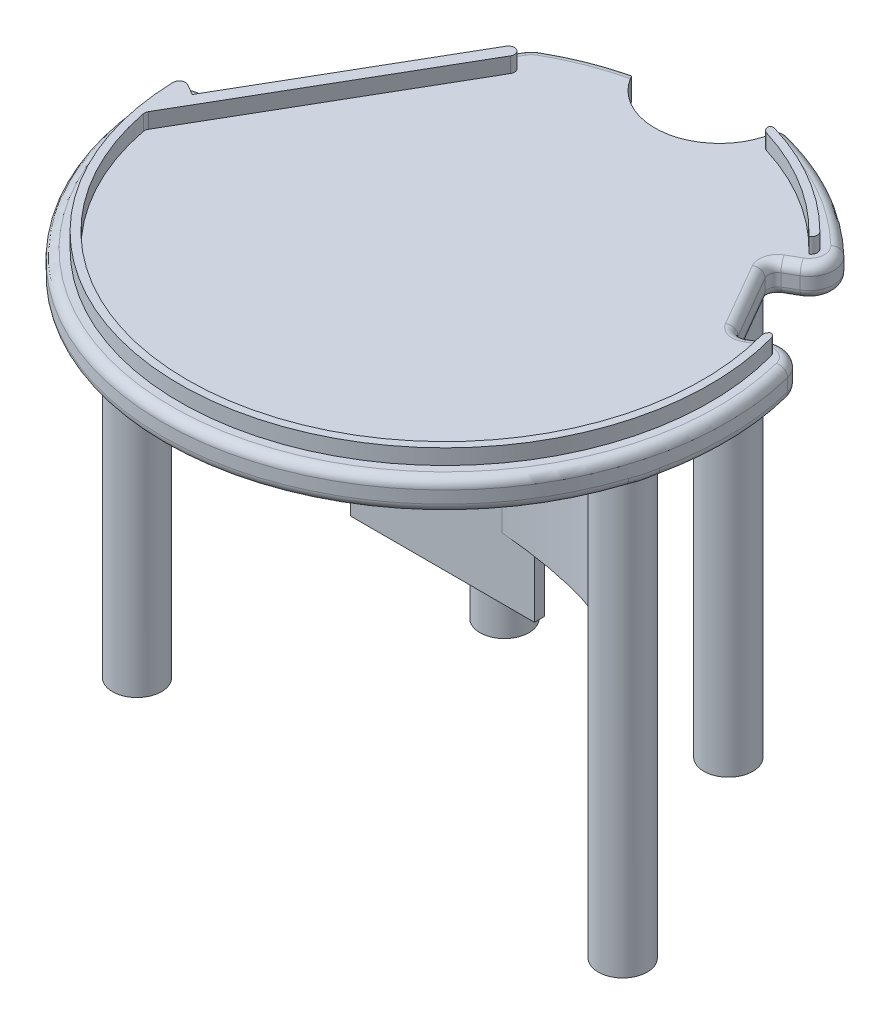
from build123d import *

# Parameters (mm, degrees)
BOSS_EXTRUDE1_DEPTH                  = 6.35
SKETCH9_R                            = 5.08
BOSS_EXTRUDE5_DEPTH                  = 88.9
BOSS_EXTRUDE6_DEPTH                  = 3.175
BOSS_EXTRUDE7_DEPTH                  = 38.1
FILLET14_R                           = 5.08
FILLET16_R                           = 1.905
FILLET17_R                           = 1.27
FILLET18_START                       = 6.35
FILLET18_DEPTH                       = 4.65
FILLET19_START                       = 6.35
FILLET19_DEPTH                       = 4.65
BOSS_EXTRUDE8_START                  = 0.508
SKETCH12_W                           = 38.1
SKETCH12_H                           = 50.8
BOSS_EXTRUDE8_DEPTH                  = 2.032
TAPPED_HOLE_FOR_4_40_HELICOIL2_D     = 3.048
TAPPED_HOLE_FOR_4_40_HELICOIL2_DEPTH = 8.128
TAPPED_HOLE_FOR_4_40_HELICOIL2_TIP   = 0.915711583


with BuildPart() as part:
    # Sketch1 → Boss-Extrude1 (new body)
    with BuildSketch(Plane(origin=(0, 0, 0), x_dir=(1, 0, 0), z_dir=(0, 1, 0))):
        with BuildLine():
            Line((-32.253592819, 37.099138511), (-40.254592819, 23.241))
            Line((-40.254592819, 23.241), (-51.728000474, 3.368475006))
            Line((-51.728000474, 3.368475006), (-58.000335883, 6.989809543))
            ThreePointArc((-58.000335883, 6.989809543), (7.066769016, -57.991009438), (54.624330022, 20.714221434))
            Line((54.624330022, 20.714221434), (45.017092819, 14.992108029))
            Line((45.017092819, 14.992108029), (35.492092819, 31.489891971))
            Line((35.492092819, 31.489891971), (45.153710606, 37.068029601))
            ThreePointArc((45.153710606, 37.068029601), (30.906009338, 49.575346563), (13.403434591, 56.861624503))
            ThreePointArc((13.403434591, 56.861624503), (2.74487785, 43.742260783), (-12.27919224, 51.488218063))
            ThreePointArc((-12.27919224, 51.488218063), (-20.066564561, 48.981099907), (-27.374593602, 45.30393787))
            Line((-27.374593602, 45.30393787), (-32.253592819, 37.099138511))
        make_face()
    extrude(amount=BOSS_EXTRUDE1_DEPTH)

    # Sketch9 → Boss-Extrude5 (add)
    with BuildSketch(Plane(origin=(0, 0, 0), x_dir=(1, 0, 0), z_dir=(0, 1, 0))):
        with Locations(Location((-50.295757775, -13.476707678, 0), (0, 0, 270))):
            Circle(SKETCH9_R)
        with Locations(Location((50.295757775, -13.476707678, 0), (0, 0, 270))):
            Circle(SKETCH9_R)
        with Locations(Location((-22.825821957, 35.148683503, 0), (0, 0, 270))):
            Circle(SKETCH9_R)
        with Locations(Location((25.22206762, 33.470814226, 0), (0, 0, 270))):
            Circle(SKETCH9_R)
    extrude(amount=-BOSS_EXTRUDE5_DEPTH)

    # Sketch11 → Boss-Extrude6 (add)
    with BuildSketch(Plane(origin=(0, 6.35, 0), x_dir=(1, 0, 0), z_dir=(0, 1, 0))):
        with BuildLine():
            Line((-50.720076519, -1.612859212), (-54.895840437, 0.79801921))
            ThreePointArc((-54.895840437, 0.79801921), (7.654945751, -54.365356041), (52.541042813, 15.925732386))
            Line((52.541042813, 15.925732386), (51.134548774, 15.088018252))
            ThreePointArc((51.134548774, 15.088018252), (12.383825031, -51.855869973), (-52.434288484, -9.645504875))
            Line((-52.434288484, -9.645504875), (-24.059325187, 39.382046715))
            Line((-24.059325187, 39.382046715), (-26.25769086, 40.654362857))
            Line((-26.25769086, 40.654362857), (-50.720076519, -1.612859212))
        make_face()
        with BuildLine():
            Line((38.582559864, 36.793701193), (39.996135536, 37.609829487))
            ThreePointArc((39.996135536, 37.609829487), (28.47417233, 46.940511736), (14.875659709, 52.847941115))
            Line((14.875659709, 52.847941115), (14.445506531, 51.31975949))
            ThreePointArc((14.445506531, 51.31975949), (27.49082663, 45.679807621), (38.582559864, 36.793701193))
        make_face()
    extrude(amount=BOSS_EXTRUDE6_DEPTH)

    # Sketch2 → Boss-Extrude7 (add)
    with BuildSketch(Plane(origin=(0, 0, 0), x_dir=(1, 0, 0), z_dir=(0, 1, 0))):
        with BuildLine():
            Line((-47.247757775, -13.476707678), (-45.215757775, -13.476707678))
            add(Edge.make_bspline(
                [(45.215757775, -13.476707678), (45.215757775, 0), (0, 0), (-45.215757775, 0), (-45.215757775, -13.476707678)],
                knots=[0, 0, 0, 1.570796327, 1.570796327, 3.141592654, 3.141592654, 3.141592654], degree=2, weights=[1, 0.707106781, 1, 0.707106781, 1]))
            Line((45.215757775, -13.476707678), (47.247757775, -13.476707678))
            add(Edge.make_bspline(
                [(47.247757775, -13.476707678), (47.247757775, 2.032), (0, 2.032), (-47.247757775, 2.032), (-47.247757775, -13.476707678)],
                knots=[0, 0, 0, 1.570796327, 1.570796327, 3.141592654, 3.141592654, 3.141592654], degree=2, weights=[1, 0.707106781, 1, 0.707106781, 1]))
        make_face()
    extrude(amount=-BOSS_EXTRUDE7_DEPTH)

    # Fillet14
    # the kernel refuses this fillet: 5.08 mm, written as the material it takes off along each edge
    with BuildSketch(Plane(origin=(45.153710606, -16.579017686, -37.068029601), x_dir=(-0.6773555259937207, 0, -0.7356558240140357), z_dir=(0, 1, 0))) as fillet14_piece_1:
        with BuildLine():
            CenterArc((6.343276332, 5.071810858), FILLET14_R, 167.362661461, 105.891082119)
            Line((1.386342405, 6.183209097), (1.287203727, 6.205437062))
            Line((1.287203727, 6.205437062), (-0.099138679, 0.022227965))
            Line((-0.099138679, 0.022227965), (-0.005766615, -0.101436217))
            ThreePointArc((-0.005766615, -0.101436217), (3.315803537, -0.195775129), (6.637373689, -0.101436217))
            Line((6.637373689, -0.101436217), (6.631607074, 0))
        make_face()
    extrude(amount=39.508035371, mode=Mode.SUBTRACT)
    with BuildSketch(Plane(origin=(-58.000335883, -21.483083714, -6.989809543), x_dir=(0.8660254037844359, 0, 0.5000000000000048), z_dir=(0, 1, 0))) as fillet14_piece_2:
        with BuildLine():
            CenterArc((8.275866801, -4.973821716), FILLET14_R, 101.734996991, 109.828725066)
            Line((3.947409441, -7.632930004), (3.860840294, -7.686112169))
            ThreePointArc((3.860840294, -7.686112169), (1.742923524, -3.935814698), (-0.093434207, -0.039907505))
            Line((-0.093434207, -0.039907505), (0, 0.1016))
            ThreePointArc((0, 0.1016), (3.621334537, 0.1016), (7.22200512, 0.099476434))
            Line((7.22200512, 0.099476434), (7.242669074, 0))
        make_face()
    extrude(amount=49.316167428, mode=Mode.SUBTRACT)
    with BuildSketch(Plane(origin=(54.624330022, -16.77772991, -20.714221434), x_dir=(-0.8591545066230238, 0, 0.5117162629322508), z_dir=(0, 1, 0))) as fillet14_piece_3:
        with BuildLine():
            CenterArc((6.412670414, 5.08), FILLET14_R, 163.403560084, 106.596439916)
            Line((1.544301569, 6.530994412), (1.446934192, 6.5600143))
            ThreePointArc((1.446934192, 6.5600143), (0.579417505, 3.311070405), (-0.100053119, 0.017661637))
            Line((-0.100053119, 0.017661637), (0, -0.1016))
            Line((0, -0.1016), (6.412670414, -0.1016))
            Line((6.412670414, -0.1016), (6.412670414, 0))
        make_face()
    extrude(amount=39.905459819, mode=Mode.SUBTRACT)
    with BuildSketch(Plane(origin=(-27.374593602, -3.435095162, -45.30393787), x_dir=(0.8625268635663396, 0, -0.5060112742087995), z_dir=(0, 1, 0))) as fillet14_piece_4:
        with BuildLine():
            CenterArc((1.308103561, -5.079572092), FILLET14_R, 89.256323848, 29.60725833)
            Line((-1.144143659, -0.630652722), (-1.193188604, -0.541674334))
            Line((-1.193188604, -0.541674334), (-0.049044944, 0.088978387))
            Line((-0.049044944, 0.088978387), (-0.00131869, 0.101591442))
            ThreePointArc((-0.00131869, 0.101591442), (0.687019032, 0.106058678), (1.375356755, 0.101591442))
            Line((1.375356755, 0.101591442), (1.374038065, 0))
        make_face()
    extrude(amount=13.220190325, mode=Mode.SUBTRACT)

    # Fillet16
    fillet16_edges = [part.edges().sort_by_distance(p)[0] for p in [
        (28.042389227, 0, -51.249593232),
        (8.001988008, 0, 57.869375216),
        (53.660044193, 0, -17.760877841),
        (-56.352470504, 0, -2.620122155),
        (42.167493863, 0, -37.675190195),
        (-27.233989523, 0, -45.210478507),
        (8.001988008, 6.35, 57.869375216),
        (28.042389227, 6.35, -51.249593232),
        (53.660044193, 6.35, -17.760877841),
        (-56.352470504, 6.35, -2.620122155),
        (42.167493863, 6.35, -37.675190195),
        (-27.233989523, 6.35, -45.210478507),
        (37.579021476, 0, -32.694780793),
        (40.254592819, 0, -23.241),
        (47.065974078, 0, -16.212430861),
        (-30.147961838, 6.35, -40.640085938),
        (-41.990796646, 0, -20.233806758),
        (-30.147961838, 0, -40.640085938),
        (-19.429137171, 0, -49.23742266),
        (2.74487785, 0, -43.742260783),
        (-41.990796646, 6.35, -20.233806758),
        (13.403434591, 3.175, -56.861624503),
        (35.492092819, 3.175, -31.489891971),
        (45.017092819, 3.175, -14.992108029),
        (-12.27919224, 3.175, -51.488218063),
        (47.065974078, 6.35, -16.212430861),
        (40.254592819, 6.35, -23.241),
        (37.579021476, 6.35, -32.694780793),
        (-19.429137171, 6.35, -49.23742266),
    ]]
    fillet(fillet16_edges, radius=FILLET16_R)

    # Fillet17
    fillet17_edges = [part.edges().sort_by_distance(p)[0] for p in [
        (-24.059325187, 7.9375, -39.382046715),
        (-54.895840437, 7.9375, -0.79801921),
        (51.134548774, 7.9375, -15.088018252),
        (-52.434288484, 7.9375, 9.645504875),
    ]]
    fillet(fillet17_edges, radius=FILLET17_R)

    # Fillet18: read off the stored shape, not the designer's step
    # Fillet18 outline → Fillet18 (cut)
    with BuildSketch(Plane(origin=(0, 0, 0), x_dir=(1, 0, 0), z_dir=(0, 1, 0)).offset(FILLET18_START)):
        with BuildLine():
            Line((-26.25769086, 40.654362857), (-26.893848931, 39.55518002))
            ThreePointArc((-26.893848931, 39.55518002), (-26.122074046, 40.146093272), (-25.158508023, 40.018204786))
            Line((-25.158508023, 40.018204786), (-26.25769086, 40.654362857))
        make_face()
        with BuildLine():
            ThreePointArc((14.445506531, 51.31975949), (15.041594109, 51.148224013), (15.635645663, 50.969765133))
            ThreePointArc((15.635645663, 50.969765133), (14.893198505, 51.575738783), (14.785610727, 52.52802903))
            Line((14.785610727, 52.52802903), (14.445506531, 51.31975949))
        make_face()
        with BuildLine():
            ThreePointArc((38.849703366, 38.792920492), (39.210095509, 37.7293232), (38.586021235, 36.795699616))
            Line((38.586021235, 36.795699616), (39.996135536, 37.609829487))
            ThreePointArc((39.996135536, 37.609829487), (39.427357306, 38.205675334), (38.849703366, 38.792920492))
        make_face()
        with BuildLine():
            ThreePointArc((51.973910084, 15.587945598), (52.558065388, 15.26651958), (52.898887021, 14.693463983))
            ThreePointArc((52.898887021, 14.693463983), (52.723565151, 15.310643673), (52.541042813, 15.925732386))
            Line((52.541042813, 15.925732386), (51.973910084, 15.587945598))
        make_face()
    extrude(amount=FILLET18_DEPTH, mode=Mode.SUBTRACT)

    # Fillet19: read off the stored shape, not the designer's step
    # Fillet19 outline → Fillet19 (cut)
    with BuildSketch(Plane(origin=(0, 0, 0), x_dir=(1, 0, 0), z_dir=(0, 1, 0)).offset(FILLET19_START)):
        with BuildLine():
            ThreePointArc((14.785610727, 52.52802903), (15.240713213, 52.654434766), (15.710532865, 52.605791402))
            ThreePointArc((15.710532865, 52.605791402), (15.293575552, 52.728518647), (14.875659709, 52.847941115))
            Line((14.875659709, 52.847941115), (14.785610727, 52.52802903))
        make_face()
        with BuildLine():
            Line((38.582559864, 36.793701193), (38.586021235, 36.795699616))
            ThreePointArc((38.586021235, 36.795699616), (38.550078377, 36.829138082), (38.515454698, 36.863940681))
            ThreePointArc((38.515454698, 36.863940681), (38.549023279, 36.828836221), (38.582559864, 36.793701193))
        make_face()
    extrude(amount=FILLET19_DEPTH, mode=Mode.SUBTRACT)

    # Sketch12 → Boss-Extrude8 (add)
    with BuildSketch(Plane.XY.offset(BOSS_EXTRUDE8_START)):
        with Locations((0, -25.4)):
            Rectangle(SKETCH12_W, SKETCH12_H)
    extrude(amount=-BOSS_EXTRUDE8_DEPTH)

    # Tapped Hole for #4-40 Helicoil2
    with Locations(Plane(origin=(0, -88.9, 0), x_dir=(-1, 0, 0), z_dir=(0, -1, 0))):
        with Locations((50.295757775, -13.476707678), (22.825821957, 35.148683503), (-25.22206762, 33.470814226), (-50.295757775, -13.476707678)):
            Hole(TAPPED_HOLE_FOR_4_40_HELICOIL2_D / 2, depth=TAPPED_HOLE_FOR_4_40_HELICOIL2_DEPTH)
            with Locations((0, 0, -(TAPPED_HOLE_FOR_4_40_HELICOIL2_DEPTH + TAPPED_HOLE_FOR_4_40_HELICOIL2_TIP / 2))):  # 118° drill point
                Cone(0, TAPPED_HOLE_FOR_4_40_HELICOIL2_D / 2, TAPPED_HOLE_FOR_4_40_HELICOIL2_TIP, mode=Mode.SUBTRACT)


solid = part.part
